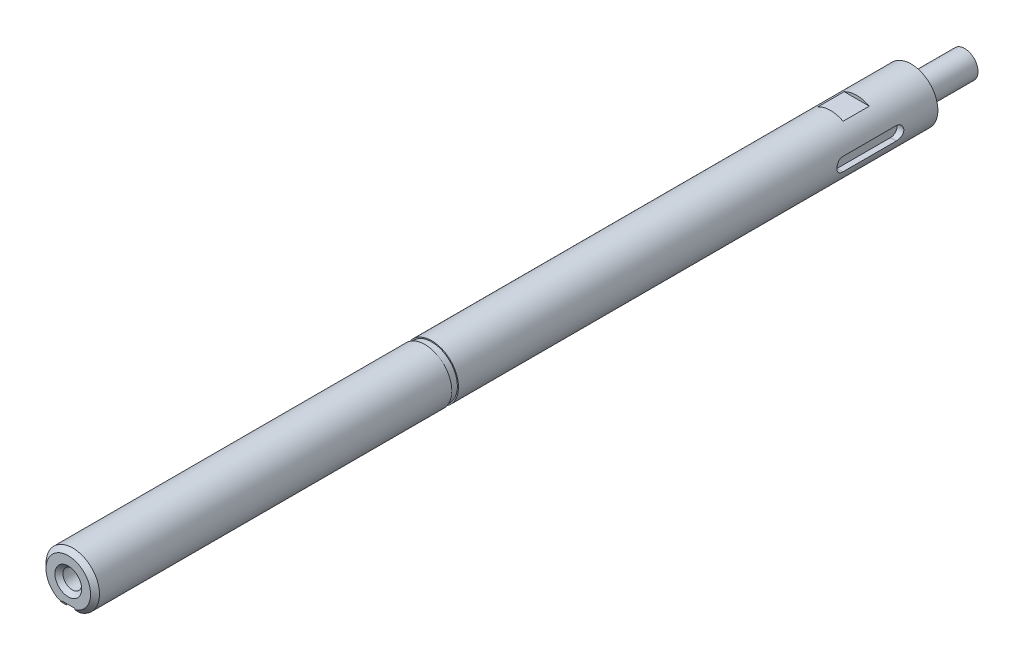
from build123d import *

# Parameters (mm, degrees)
SKETCH1_W                   = 107.1
SKETCH1_H                   = 6
SKETCH18_R                  = 6
BOSS_EXTRUDE1_DEPTH         = 72.5
CUT_EXTRUDE4_REACH          = 113.936
CUT_EXTRUDE4_END_RADIUS     = 6
CUT_EXTRUDE4_START          = -4.5
M5_TAPPED_HOLE3_D           = 4.2
M5_TAPPED_HOLE3_DEPTH       = 14
M5_TAPPED_HOLE3_CSINK_D     = 6
M5_TAPPED_HOLE3_CSINK_ANGLE = 90
M5_TAPPED_HOLE3_TIP         = 1.2618073
BOSS_EXTRUDE2_START         = 21.4
SKETCH22_R                  = 6
BOSS_EXTRUDE2_DEPTH         = 21.4
CHAMFER2_SIZE               = 1
SKETCH25_W                  = 3
SKETCH25_H                  = 3
CUT_EXTRUDE5_DEPTH          = 30
FILLET2_R                   = 1.5
SKETCH30_OUTSIDE_W          = 54.344
SKETCH30_OUTSIDE_H          = 54.344
SKETCH30_OUTSIDE_R          = 3
CUT_EXTRUDE10_DEPTH         = 12
CUT_EXTRUDE11_DEPTH         = 129.779850918
CUT_EXTRUDE11_DEPTH_BACK    = 129.779850918
SKETCH31_W                  = 5.87
SKETCH31_H                  = 22.819621357
SKETCH31_H_2                = 22.855520271
CUT_EXTRUDE12_START         = 4.5
CUT_EXTRUDE12_DEPTH         = 125.279850918
CUT_EXTRUDE13_START         = 50.3
SKETCH33_OUTSIDE_W          = 54.344
SKETCH33_OUTSIDE_H          = 54.344
SKETCH33_OUTSIDE_R          = 5.75
CUT_EXTRUDE13_DEPTH         = 1.5


with BuildPart() as part:
    # Sketch1 → Revolve1 (revolve)
    with BuildSketch(Plane(origin=(0, 0, 0), x_dir=(0, 0, -1), z_dir=(1, 0, 0)), mode=Mode.PRIVATE) as revolve1_sk:
        with Locations((53.55, 3)):
            Rectangle(SKETCH1_W, SKETCH1_H)
    revolve(revolve1_sk.sketch.rotate(Axis((0, 0, 38.636074766), (0, 0, -1)), 90), axis=Axis((0, 0, 38.636074766), (0, 0, -1)))

    # Sketch18 → Boss-Extrude1 (add)
    with BuildSketch(Plane.XY):
        Circle(SKETCH18_R)
    extrude(amount=BOSS_EXTRUDE1_DEPTH)

    # Cut-Extrude4: up to this cylinder (the profile starts inside it)
    cut_extrude4_end = Plane(origin=(0, 0, 57.9), z_dir=(0, 0, 1)) * Cylinder(CUT_EXTRUDE4_END_RADIUS, 240.872, mode=Mode.PRIVATE)
    # Sketch19 → Cut-Extrude4 (cut, up to the surface)
    with BuildSketch(Plane(origin=(0, 0, 0), x_dir=(1, 0, 0), z_dir=(0, 1, 0)).offset(CUT_EXTRUDE4_START), mode=Mode.PRIVATE) as cut_extrude4_sk1:
        with BuildLine():
            Line((-1.5, -63.9), (-1.5, -51.9))
            ThreePointArc((-1.5, -51.9), (0, -50.4), (1.5, -51.9))
            Line((1.5, -51.9), (1.5, -63.9))
            ThreePointArc((1.5, -63.9), (0, -65.4), (-1.5, -63.9))
        make_face()
    cut_extrude4_tool1 = extrude(cut_extrude4_sk1.sketch, amount=-CUT_EXTRUDE4_REACH, mode=Mode.PRIVATE) & cut_extrude4_end
    add(cut_extrude4_tool1.solids().sort_by_distance((0, -4.5, 57.9))[0], mode=Mode.SUBTRACT)

    # M5 Tapped Hole3
    with Locations(Plane.XY.offset(72.5)):
        with Locations((0, 0)):
            CounterSinkHole(M5_TAPPED_HOLE3_D / 2, M5_TAPPED_HOLE3_CSINK_D / 2, depth=M5_TAPPED_HOLE3_DEPTH, counter_sink_angle=M5_TAPPED_HOLE3_CSINK_ANGLE)
            with Locations((0, 0, -(M5_TAPPED_HOLE3_DEPTH + M5_TAPPED_HOLE3_TIP / 2))):  # 118° drill point
                Cone(0, M5_TAPPED_HOLE3_D / 2, M5_TAPPED_HOLE3_TIP, mode=Mode.SUBTRACT)

    # Sketch22 → Boss-Extrude2 (add)
    with BuildSketch(Plane(origin=(0, 0, -107.1), x_dir=(-1, 0, 0), z_dir=(0, 0, -1)).offset(BOSS_EXTRUDE2_START)):
        with Locations(Location((0, 0, 0), (0, 0, 180))):
            Circle(SKETCH22_R)
    extrude(amount=-BOSS_EXTRUDE2_DEPTH)

    # Chamfer2
    chamfer2_edges = [part.edges().sort_by_distance(p)[0] for p in [
        (-6, 0, 72.5),
    ]]
    chamfer(chamfer2_edges, length=CHAMFER2_SIZE)

    # Sketch25 → Cut-Extrude5 (cut)
    with BuildSketch(Plane.XY.offset(72.5)):
        with Locations((0, -6)):
            Rectangle(SKETCH25_W, SKETCH25_H)
    extrude(amount=-CUT_EXTRUDE5_DEPTH, mode=Mode.SUBTRACT)

    # Fillet2
    fillet2_edges = [part.edges().sort_by_distance(p)[0] for p in [
        (1.5, -5.15473751, 42.5),
        (-1.5, -5.15473751, 42.5),
    ]]
    fillet(fillet2_edges, radius=FILLET2_R - 0.0001)  # a hair under: the kernel refuses the full size

    # Sketch30 outside → Cut-Extrude10 (cut)
    with BuildSketch(Plane(origin=(0, 0, -128.5), x_dir=(-1, 0, 0), z_dir=(0, 0, -1))):
        Rectangle(SKETCH30_OUTSIDE_W, SKETCH30_OUTSIDE_H)
        Circle(SKETCH30_OUTSIDE_R, mode=Mode.SUBTRACT)
    extrude(amount=-CUT_EXTRUDE10_DEPTH, mode=Mode.SUBTRACT)

    # Sketch31 → Cut-Extrude11 (cut, two sides: drawn at the far end of the back side and taken through both)
    with BuildSketch(Plane(origin=(0, 0, 0), x_dir=(0, 0, -1), z_dir=(1, 0, 0)).offset(-CUT_EXTRUDE11_DEPTH_BACK)):
        with Locations((101.365, -16.709810679)):
            Rectangle(SKETCH31_W, SKETCH31_H)
        with Locations((101.365, 16.727760135)):
            Rectangle(SKETCH31_W, SKETCH31_H_2)
    extrude(amount=CUT_EXTRUDE11_DEPTH + CUT_EXTRUDE11_DEPTH_BACK, mode=Mode.SUBTRACT)

    # Sketch32 → Cut-Extrude12 (cut, through all)
    with BuildSketch(Plane(origin=(0, 0, 0), x_dir=(0, 0, -1), z_dir=(1, 0, 0)).offset(CUT_EXTRUDE12_START)):
        with BuildLine():
            Line((107.365, -1.5), (95.365, -1.5))
            ThreePointArc((95.365, -1.5), (93.865, 0), (95.365, 1.5))
            Line((95.365, 1.5), (107.365, 1.5))
            ThreePointArc((107.365, 1.5), (108.865, 0), (107.365, -1.5))
        make_face()
    extrude(amount=CUT_EXTRUDE12_DEPTH, mode=Mode.SUBTRACT)

    # Sketch33 outside → Cut-Extrude13 (cut)
    with BuildSketch(Plane(origin=(0, 0, 41.3), x_dir=(-1, 0, 0), z_dir=(0, 0, -1)).offset(CUT_EXTRUDE13_START)):
        Rectangle(SKETCH33_OUTSIDE_W, SKETCH33_OUTSIDE_H)
        Circle(SKETCH33_OUTSIDE_R, mode=Mode.SUBTRACT)
    extrude(amount=-CUT_EXTRUDE13_DEPTH, mode=Mode.SUBTRACT)


solid = part.part
